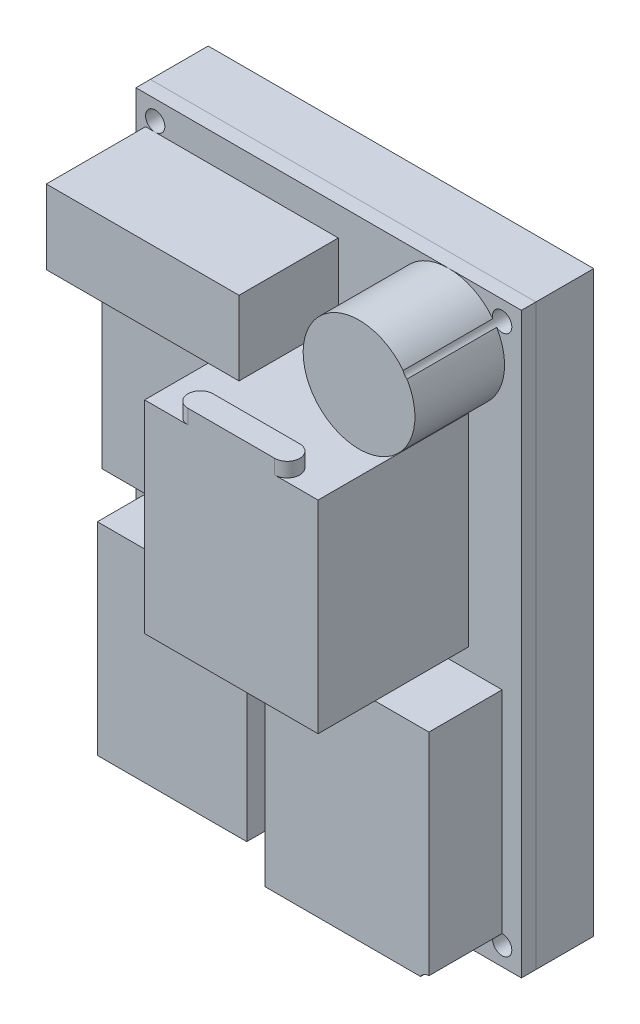
from build123d import *
from build123d.topology import SkipClean

# Parameters (mm, degrees)
SKETCH1_W           = 60
SKETCH1_H           = 40
SKETCH1_R           = 1
BOSS_EXTRUDE1_DEPTH = 1.5
SKETCH2_W           = 15.5
SKETCH2_H           = 21
SKETCH2_W_2         = 11
SKETCH2_H_2         = 15
BOSS_EXTRUDE2_DEPTH = 6
BOSS_EXTRUDE3_DEPTH = 7.6
SKETCH2_4_W         = 18
SKETCH2_4_H         = 21
BOSS_EXTRUDE4_DEPTH = 15.6
BOSS_EXTRUDE5_DEPTH = 9.3
SKETCH2_6_W         = 20
SKETCH2_6_H         = 7.7
BOSS_EXTRUDE6_DEPTH = 10.3
SKETCH1_3_W         = 60
SKETCH1_3_H         = 40
SKETCH1_3_R         = 1
BOSS_EXTRUDE7_DEPTH = 6
BOSS_EXTRUDE8_DEPTH = 1.5


with BuildPart() as part:
    # Sketch1 → Boss-Extrude1 (new body)
    with BuildSketch(Plane(origin=(0, 0, 0), x_dir=(0, 1, 0), z_dir=(0, 0, 1))):
        Rectangle(SKETCH1_W, SKETCH1_H)
        with Locations((28, 18)):
            Circle(SKETCH1_R, mode=Mode.SUBTRACT)
        with Locations((-28, 18)):
            Circle(SKETCH1_R, mode=Mode.SUBTRACT)
        with Locations((-28, -18)):
            Circle(SKETCH1_R, mode=Mode.SUBTRACT)
        with Locations((28, -18)):
            Circle(SKETCH1_R, mode=Mode.SUBTRACT)
    extrude(amount=BOSS_EXTRUDE1_DEPTH)

    # Sketch2 → Boss-Extrude2 (add)
    with BuildSketch(Plane.XY.offset(1.5)):
        with Locations((-10.25, -15.5)):
            Rectangle(SKETCH2_W, SKETCH2_H)
        with Locations((-12, 7.5)):
            Rectangle(SKETCH2_W_2, SKETCH2_H_2)
    extrude(amount=BOSS_EXTRUDE2_DEPTH)

    # Sketch2<3> → Boss-Extrude3 (add)
    with SkipClean():  # the faces are left unmerged after this step: merging them gives an invalid solid
        with BuildSketch(Plane.XY.offset(1.5)):
            with BuildLine():
                Line((1, -5.1), (1, -27.5))
                Line((1, -27.5), (17.133974596, -27.5))
                ThreePointArc((17.133974596, -27.5), (17.5, -27.133974596), (18, -27))
                Line((18, -27), (18, -5.1))
                Line((18, -5.1), (1, -5.1))
            make_face()
        extrude(amount=BOSS_EXTRUDE3_DEPTH)

    # Sketch2<4> → Boss-Extrude4 (add)
    with SkipClean():  # the faces are left unmerged after this step: merging them gives an invalid solid
        with BuildSketch(Plane.XY.offset(1.5)):
            with Locations((5.5, 7.5)):
                Rectangle(SKETCH2_4_W, SKETCH2_4_H)
        extrude(amount=BOSS_EXTRUDE4_DEPTH)

    # Sketch2<5> → Boss-Extrude5 (add)
    with SkipClean():  # the faces are left unmerged after this step: merging them gives an invalid solid
        with BuildSketch(Plane.XY.offset(1.5)):
            with BuildLine():
                ThreePointArc((17.029376138, 27.759398009), (6.963635922, 22.318561933), (18.25, 24.2))
                ThreePointArc((18.25, 24.2), (18.039854669, 25.747102058), (17.424646629, 27.182095056))
                ThreePointArc((17.424646629, 27.182095056), (17.174875114, 27.435049628), (17.029376138, 27.759398009))
            make_face()
        extrude(amount=BOSS_EXTRUDE5_DEPTH)

    # Sketch2<6> → Boss-Extrude6 (add)
    with SkipClean():  # the faces are left unmerged after this step: merging them gives an invalid solid
        with BuildSketch(Plane.XY.offset(1.5)):
            with Locations((-9, 23.15)):
                Rectangle(SKETCH2_6_W, SKETCH2_6_H)
        extrude(amount=BOSS_EXTRUDE6_DEPTH)

    # Sketch4 → Boss-Extrude8 (add)
    with SkipClean():  # the faces are left unmerged after this step: merging them gives an invalid solid
        with BuildSketch(Plane(origin=(0, 18, 0), x_dir=(-1, 0, 0), z_dir=(0, 1, 0))):
            with BuildLine():
                Line((-10, 17.1), (-1, 17.1))
                ThreePointArc((-1, 17.1), (0.3, 15.8), (-1, 14.5))
                Line((-1, 14.5), (-10, 14.5))
                ThreePointArc((-10, 14.5), (-11.3, 15.8), (-10, 17.1))
            make_face()
        extrude(amount=BOSS_EXTRUDE8_DEPTH)


with BuildPart() as body_2:
    # Sketch1<3> → Boss-Extrude7 (new body)
    with BuildSketch(Plane(origin=(0, 0, 0), x_dir=(0, 1, 0), z_dir=(0, 0, 1))):
        Rectangle(SKETCH1_3_W, SKETCH1_3_H)
        with Locations((28, 18)):
            Circle(SKETCH1_3_R, mode=Mode.SUBTRACT)
        with Locations((-28, 18)):
            Circle(SKETCH1_3_R, mode=Mode.SUBTRACT)
        with Locations((-28, -18)):
            Circle(SKETCH1_3_R, mode=Mode.SUBTRACT)
        with Locations((28, -18)):
            Circle(SKETCH1_3_R, mode=Mode.SUBTRACT)
    extrude(amount=-BOSS_EXTRUDE7_DEPTH)


solid = Compound([part.part, body_2.part])
